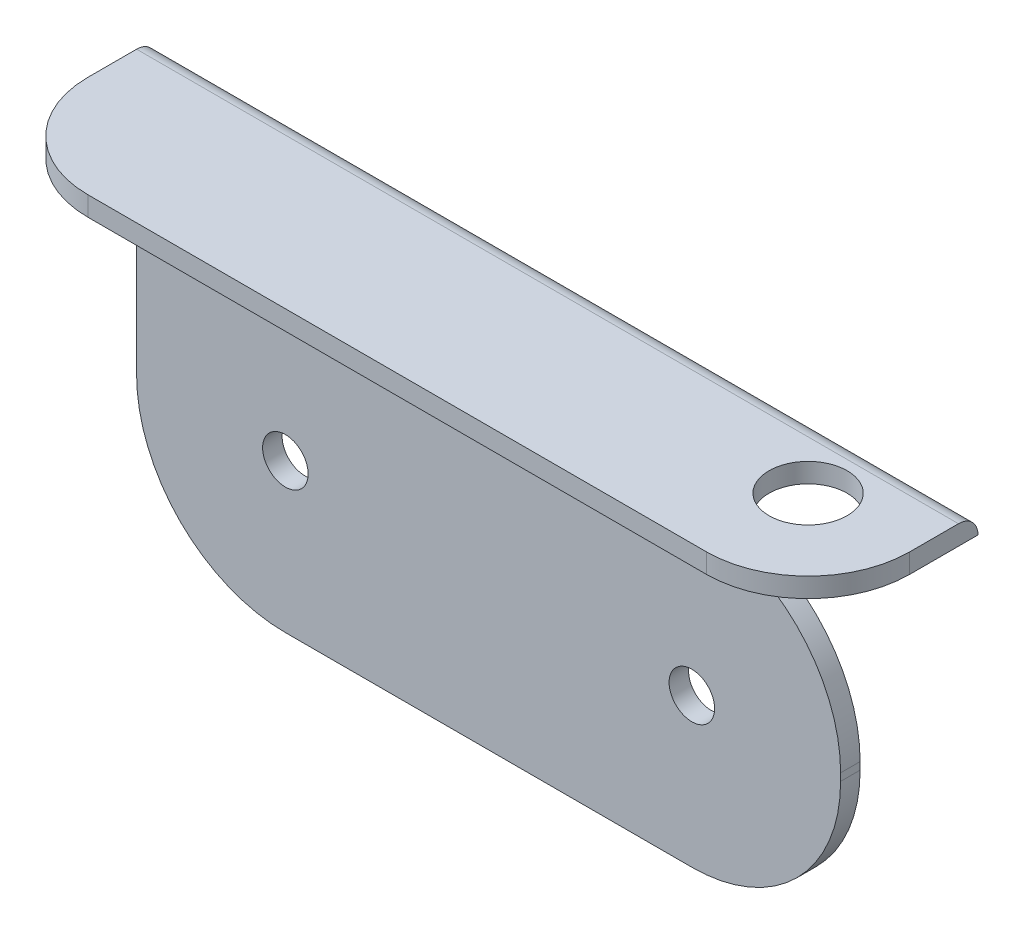
from build123d import *

# Parameters (mm, degrees)
SKETCH1_R           = 1.778
BOSS_EXTRUDE1_DEPTH = 1.524
SKETCH2_W           = 19.05
SKETCH2_H           = 1.524
BOSS_EXTRUDE2_DEPTH = 11.7475
SKETCH3_R           = 3.048
CUT_EXTRUDE2_DEPTH  = 13.9446
CUT_EXTRUDE3_DEPTH  = 13.9446
SKETCH5_W           = 45.1485
SKETCH5_H           = 1.524
BOSS_EXTRUDE3_DEPTH = 11.7475
FILLET1_R           = 7.9375
FILLET3_R           = 11.6205
FILLET4_R           = 11.6205
FILLET5_R           = 1.524
FILLET6_R           = 1.524
FILLET7_R           = 7.9375


with BuildPart() as part:
    # Sketch1 → Boss-Extrude1 (new body)
    with BuildSketch(Plane.XY):
        Polygon((27.4955, 11.6205), (36.703, 20.5105), (36.703, 22.0345), (-27.4955, 22.0345), (-27.4955, 7.4295), (-27.4955, -11.6205), (27.4955, -11.6205), align=None)
        with Locations(Location((15.875, 0, 0), (0, 0, 180))):
            Circle(SKETCH1_R, mode=Mode.SUBTRACT)
        with Locations(Location((-15.875, 0, 0), (0, 0, 180))):
            Circle(SKETCH1_R, mode=Mode.SUBTRACT)
    extrude(amount=BOSS_EXTRUDE1_DEPTH)

    # Sketch2 → Boss-Extrude2 (add)
    with BuildSketch(Plane.XY.offset(1.524)):
        with Locations((27.178, 21.2725)):
            Rectangle(SKETCH2_W, SKETCH2_H)
    extrude(amount=BOSS_EXTRUDE2_DEPTH)

    # Sketch3 → Cut-Extrude2 (cut)
    with BuildSketch(Plane.XZ.offset(-20.5105)):
        with Locations((28.7655, 5.334)):
            Circle(SKETCH3_R)
    extrude(amount=-CUT_EXTRUDE2_DEPTH, mode=Mode.SUBTRACT)

    # Sketch4 → Cut-Extrude3 (cut)
    with BuildSketch(Plane(origin=(0, 0, 0), x_dir=(-1, 0, 0), z_dir=(0, 0, -1))):
        with BuildLine():
            Line((-19.8755, 11.6205), (-36.703, 11.6205))
            Line((-36.703, 11.6205), (-36.703, 20.5105))
            Line((-36.703, 20.5105), (-19.8755, 20.5105))
            ThreePointArc((-19.8755, 20.5105), (-18.079448776, 19.766551224), (-17.3355, 17.9705))
            Line((-17.3355, 17.9705), (-17.3355, 14.1605))
            ThreePointArc((-17.3355, 14.1605), (-18.079448776, 12.364448776), (-19.8755, 11.6205))
        make_face()
    extrude(amount=-CUT_EXTRUDE3_DEPTH, mode=Mode.SUBTRACT)

    # Sketch5 → Boss-Extrude3 (add)
    with BuildSketch(Plane.XY.offset(1.524)):
        with Locations((-4.92125, 21.2725)):
            Rectangle(SKETCH5_W, SKETCH5_H)
    extrude(amount=BOSS_EXTRUDE3_DEPTH)

    # Fillet1
    fillet1_edges = [part.edges().sort_by_distance(p)[0] for p in [
        (36.703, 21.2725, 13.2715),
    ]]
    fillet(fillet1_edges, radius=FILLET1_R)

    # Fillet3
    fillet3_edges = [part.edges().sort_by_distance(p)[0] for p in [
        (27.4955, -11.6205, 0.762),
    ]]
    fillet(fillet3_edges, radius=FILLET3_R)

    # Fillet4
    fillet4_edges = [part.edges().sort_by_distance(p)[0] for p in [
        (-27.4955, -11.6205, 0.762),
        (27.4955, 11.6205, 0.762),
    ]]
    fillet(fillet4_edges, radius=FILLET4_R)

    # Fillet5
    fillet5_edges = [part.edges().sort_by_distance(p)[0] for p in [
        (-3.81, 20.5105, 1.524),
    ]]
    fillet(fillet5_edges, radius=FILLET5_R)

    # Fillet6
    fillet6_edges = [part.edges().sort_by_distance(p)[0] for p in [
        (4.60375, 22.0345, 0),
    ]]
    fillet(fillet6_edges, radius=FILLET6_R - 0.0001)  # a hair under: the kernel refuses the full size

    # Fillet7
    fillet7_edges = [part.edges().sort_by_distance(p)[0] for p in [
        (-27.4955, 21.2725, 13.2715),
    ]]
    fillet(fillet7_edges, radius=FILLET7_R)


solid = part.part
